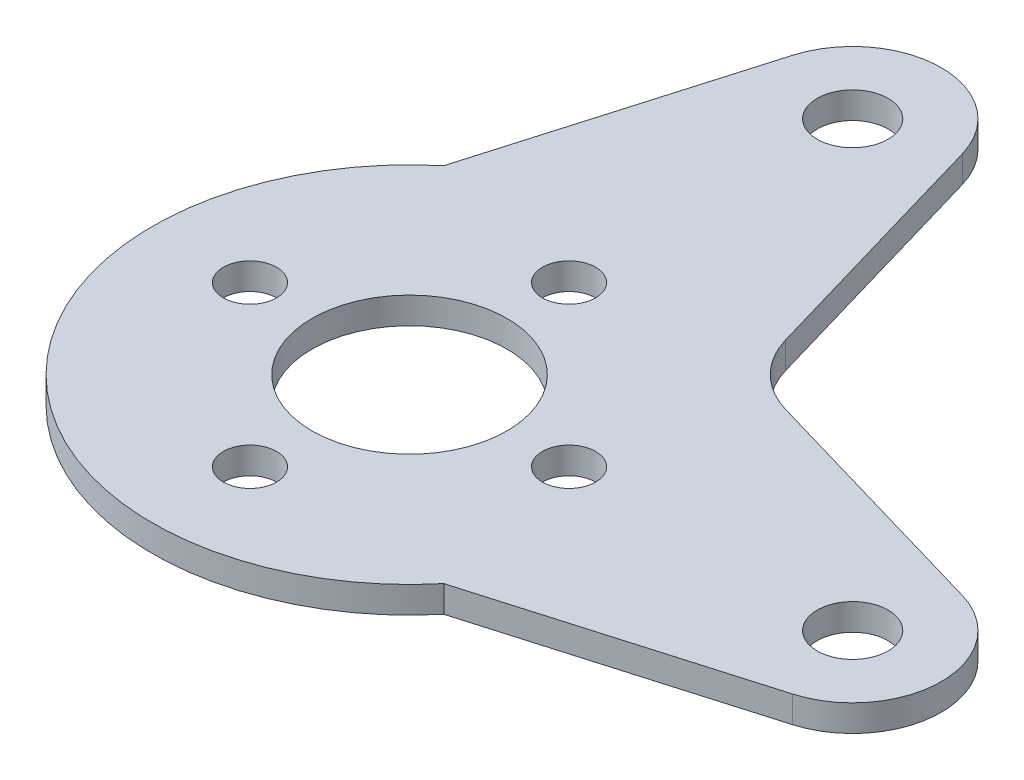
from build123d import *

# Parameters (mm, degrees)
SZKIC1_R                    = 11
SZKIC1_R_2                  = 3
SZKIC1_R_3                  = 4
DODANIE_WYCI_GNI_CIE1_DEPTH = 3


with BuildPart() as part:
    # Szkic1 → Dodanie-wyciągnięcie1 (new body)
    with BuildSketch(Plane(origin=(0, 0, 0), x_dir=(1, 0, 0), z_dir=(0, 1, 0))):
        with BuildLine():
            Line((22.347667772, -18.481930233), (52.8, -9.6))
            ThreePointArc((52.8, -9.6), (60, 0), (52.8, 9.6))
            Line((52.8, 9.6), (24.619354839, 17.819354839))
            ThreePointArc((24.619354839, 17.819354839), (20.348287027, 20.348287027), (17.819354839, 24.619354839))
            Line((17.819354839, 24.619354839), (9.6, 52.8))
            ThreePointArc((9.6, 52.8), (0, 60), (-9.6, 52.8))
            Line((-9.6, 52.8), (-18.481930233, 22.347667772))
            ThreePointArc((-18.481930233, 22.347667772), (-20.506096654, -20.506096654), (22.347667772, -18.481930233))
        make_face()
        Circle(SZKIC1_R, mode=Mode.SUBTRACT)
        with Locations((18, 0)):
            Circle(SZKIC1_R_2, mode=Mode.SUBTRACT)
        with Locations((50, 0)):
            Circle(SZKIC1_R_3, mode=Mode.SUBTRACT)
        with Locations((0, 50)):
            Circle(SZKIC1_R_3, mode=Mode.SUBTRACT)
        with Locations((-18, 0)):
            Circle(SZKIC1_R_2, mode=Mode.SUBTRACT)
        with Locations((0, -18)):
            Circle(SZKIC1_R_2, mode=Mode.SUBTRACT)
        with Locations((0, 18)):
            Circle(SZKIC1_R_2, mode=Mode.SUBTRACT)
    extrude(amount=DODANIE_WYCI_GNI_CIE1_DEPTH)


solid = part.part
